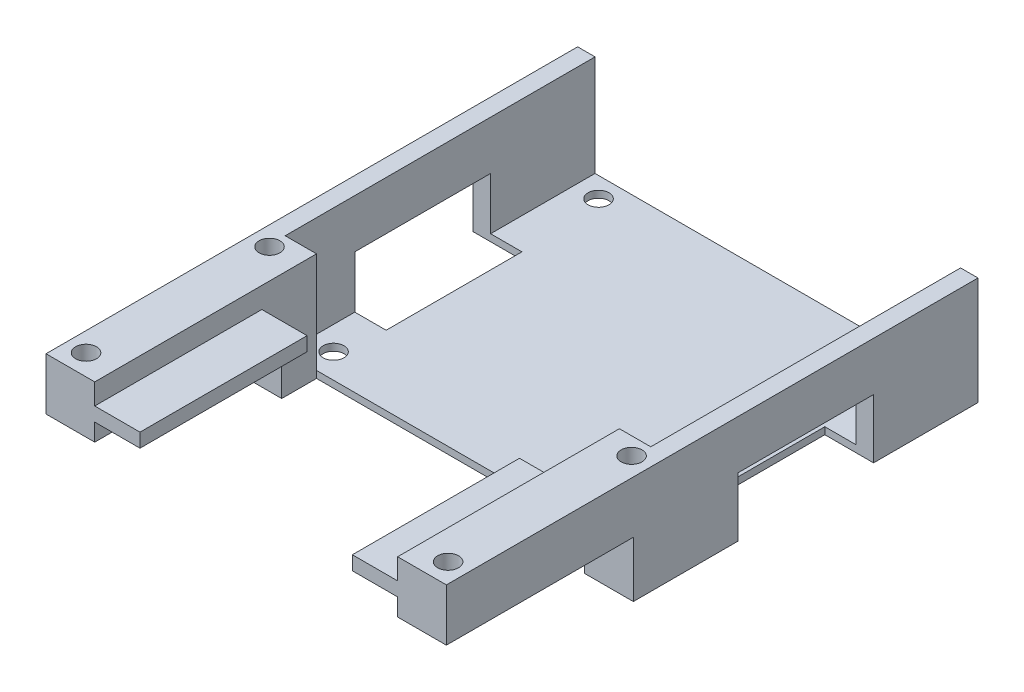
from build123d import *

# Parameters (mm, degrees)
SKETCH1_W                = 52.5
SKETCH1_H                = 44.5
BOSS_EXTRUDE1_DEPTH      = 1
BOSS_EXTRUDE2_DEPTH      = 15.5
F_3_0_3_DIAMETER_HOLE1_D = 3
SKETCH6_W                = 6.5
SKETCH6_H                = 2
BOSS_EXTRUDE3_DEPTH      = 24
SKETCH6_4_W              = 7
SKETCH6_4_H              = 8
CUT_EXTRUDE1_DEPTH       = 26.85
SKETCH8_W                = 7
SKETCH8_H                = 19.5
CUT_EXTRUDE2_DEPTH       = 8.5
CUT_EXTRUDE3_DEPTH       = 0.3


with BuildPart() as part:
    # Sketch1 → Boss-Extrude1 (new body)
    with BuildSketch(Plane(origin=(0, 0, 0), x_dir=(1, 0, 0), z_dir=(0, 1, 0))):
        with Locations((0, 54.1)):
            Rectangle(SKETCH1_W, SKETCH1_H)
    extrude(amount=BOSS_EXTRUDE1_DEPTH)

    # Sketch1<3> → Boss-Extrude2 (add)
    with BuildSketch(Plane(origin=(0, 0, 0), x_dir=(1, 0, 0), z_dir=(0, 1, 0))):
        Polygon((-26.25, 76.35), (-28.75, 76.35), (-28.75, 0), (-21.75, 0), (-21.75, 31.85), (-26.25, 31.85), align=None)
        Polygon((28.75, 76.35), (26.25, 76.35), (26.25, 31.85), (21.75, 31.85), (21.75, 0), (28.75, 0), align=None)
    extrude(amount=BOSS_EXTRUDE2_DEPTH)

    # Ø3.0 (3) Diameter Hole1 (through all)
    with Locations(Plane(origin=(0, 0, 0), x_dir=(-1, 0, 0), z_dir=(0, -1, 0))):
        with Locations((-22.85, 73.45), (22.85, 73.45), (26, 29.35), (22.85, 35.4), (-22.85, 35.4), (-26, 29.35), (-26, 3), (26, 3), (-30.25, 71.35), (30.25, 71.35)):
            Hole(F_3_0_3_DIAMETER_HOLE1_D / 2)

    # Sketch6 → Boss-Extrude3 (add)
    with BuildSketch(Plane.XY):
        with Locations((-18.5, 11.5)):
            Rectangle(SKETCH6_W, SKETCH6_H)
        with Locations((18.5, 11.5)):
            Rectangle(SKETCH6_W, SKETCH6_H)
    extrude(amount=-BOSS_EXTRUDE3_DEPTH)

    # Sketch6<4> → Cut-Extrude1 (cut)
    with BuildSketch(Plane.XY):
        with Locations((-25.25, 4)):
            Rectangle(SKETCH6_4_W, SKETCH6_4_H)
        with Locations((25.25, 4)):
            Rectangle(SKETCH6_4_W, SKETCH6_4_H)
    extrude(amount=-CUT_EXTRUDE1_DEPTH, mode=Mode.SUBTRACT)

    # Sketch8 → Cut-Extrude2 (cut)
    with BuildSketch(Plane.XZ):
        with Locations((-25.25, -51.6)):
            Rectangle(SKETCH8_W, SKETCH8_H)
        with Locations((25.25, -51.6)):
            Rectangle(SKETCH8_W, SKETCH8_H)
    extrude(amount=-CUT_EXTRUDE2_DEPTH, mode=Mode.SUBTRACT)

    # Sketch9 → Cut-Extrude3 (cut)
    with BuildSketch(Plane.XZ):
        Polygon((-3.689843301, -66.963585904), (-0.766939618, -56.191794443), (-9.599348257, -56.191794443), (4.207929605, -40.061796941), (3.001024061, -51.044637389), (10.995078197, -51.044637389), align=None)
    extrude(amount=-CUT_EXTRUDE3_DEPTH, mode=Mode.SUBTRACT)


solid = part.part
